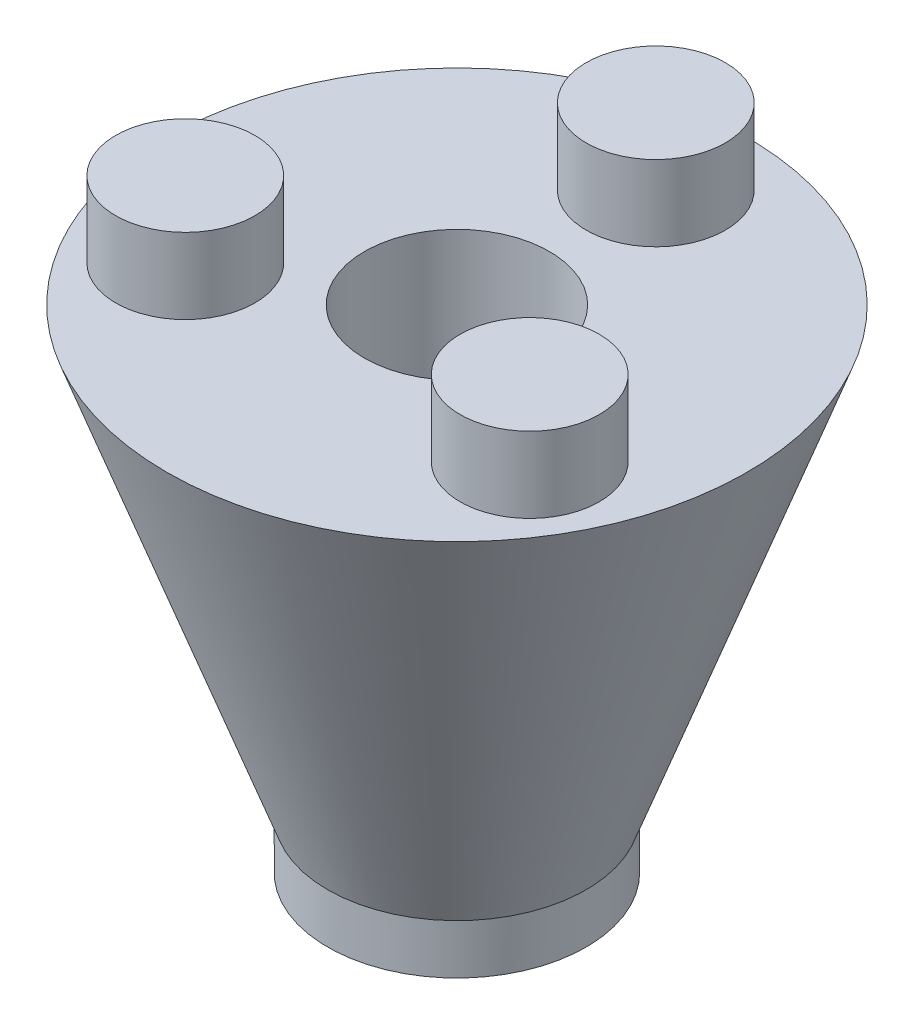
from build123d import *

# Parameters (mm, degrees)
SKETCH1_R            = 6.500000081
ANGLEBODY_DEPTH      = 22.225
ANGLEBODY_DRAFT      = -20
SKETCH2_R            = 4.649999971
CENTERHOLE_DEPTH     = 31.325606131
SKETCH2_3_R          = 3.499999985
F_40TPEGS_DEPTH      = 3.80000002
SKETCH3_R            = 6.500000081
SKETCH3_R_2          = 3.300000004
F_20TINTERFACE_DEPTH = 2.50000008


with BuildPart() as part:
    # Sketch1 → AngleBody (with draft: the straight prism first)
    with BuildSketch(Plane(origin=(0, 0, 0), x_dir=(1, 0, 0), z_dir=(0, 1, 0))):
        Circle(SKETCH1_R)
    extrude(amount=ANGLEBODY_DEPTH)
    # AngleBody: the draft: its side faces are tilted about the plane it starts from
    anglebody_sides = [part.faces().sort_by_distance(p)[0] for p in [
        (-6.500000081, 11.1125, 0),
    ]]
    draft(anglebody_sides, Plane(origin=(0, 0, 0), x_dir=(1, 0, 0), z_dir=(0, 1, 0)), ANGLEBODY_DRAFT)

    # Sketch2 → CenterHole (cut, through all)
    with BuildSketch(Plane(origin=(0, 22.225, 0), x_dir=(1, 0, 0), z_dir=(0, 1, 0))):
        Circle(SKETCH2_R)
    extrude(amount=-CENTERHOLE_DEPTH, mode=Mode.SUBTRACT)

    # Sketch2<3> → 40tPegs (add)
    with BuildSketch(Plane(origin=(0, 22.225, 0), x_dir=(1, 0, 0), z_dir=(0, 1, 0))):
        with Locations((-8.660254095, -5.000000033)):
            Circle(SKETCH2_3_R)
        with Locations((8.660254095, -5.000000033)):
            Circle(SKETCH2_3_R)
        with Locations((0, 10.000000066)):
            Circle(SKETCH2_3_R)
    extrude(amount=F_40TPEGS_DEPTH)

    # Sketch3 → 20tInterface (add)
    with BuildSketch(Plane.XZ):
        Circle(SKETCH3_R)
        Circle(SKETCH3_R_2, mode=Mode.SUBTRACT)
    extrude(amount=F_20TINTERFACE_DEPTH)


solid = part.part
